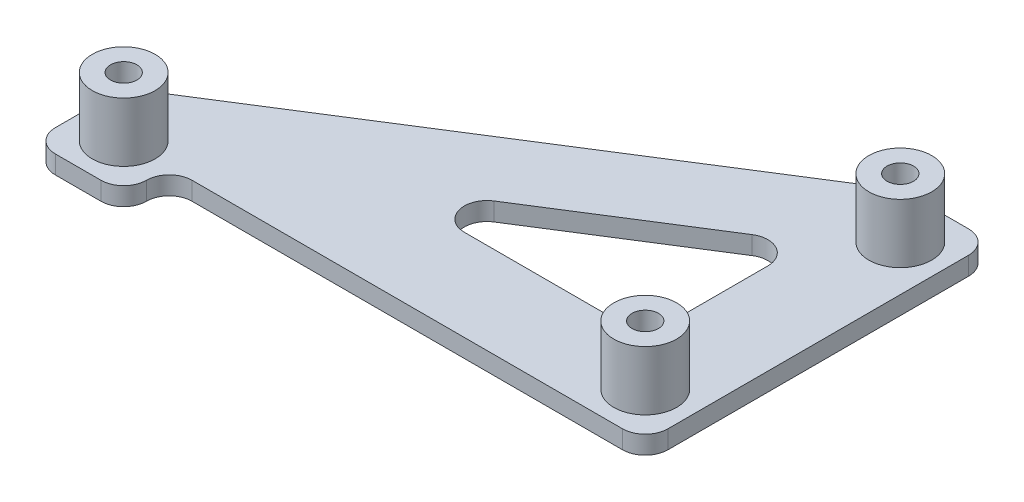
from build123d import *

# Parameters (mm, degrees)
SKETCH1_R             = 3.45
SKETCH1_R_2           = 1.45
BOSS_EXTRUDE1_DEPTH   = 8.5
BOSS_EXTRUDE1_2_DEPTH = 8.5
BOSS_EXTRUDE1_3_DEPTH = 8.5
SKETCH2_R             = 1.45
BOSS_EXTRUDE2_DEPTH   = 2
FILLET2_R             = 2.5


with BuildPart() as part:
    # Sketch1 → Boss-Extrude1 (new body)
    with BuildSketch(Plane(origin=(0, 0, 0), x_dir=(1, 0, 0), z_dir=(0, 1, 0))):
        with Locations(Location((-52.25, 5, 0), (0, 0, 270))):
            Circle(SKETCH1_R)
        with Locations(Location((-52.25, 5, 0), (0, 0, 270))):
            Circle(SKETCH1_R_2, mode=Mode.SUBTRACT)
    extrude(amount=BOSS_EXTRUDE1_DEPTH)



with BuildPart() as body_2:
    # Sketch1 → Boss-Extrude1 2 (new body)
    with BuildSketch(Plane(origin=(0, 0, 0), x_dir=(1, 0, 0), z_dir=(0, 1, 0))):
        with Locations(Location((0, 0, 0), (0, 0, 270))):
            Circle(SKETCH1_R)
        with Locations(Location((0, 0, 0), (0, 0, 270))):
            Circle(SKETCH1_R_2, mode=Mode.SUBTRACT)
    extrude(amount=BOSS_EXTRUDE1_2_DEPTH)


with BuildPart() as body_3:
    # Sketch1 → Boss-Extrude1 3 (new body)
    with BuildSketch(Plane(origin=(0, 0, 0), x_dir=(1, 0, 0), z_dir=(0, 1, 0))):
        with Locations(Location((0, -28, 0), (0, 0, 270))):
            Circle(SKETCH1_R)
        with Locations(Location((0, -28, 0), (0, 0, 270))):
            Circle(SKETCH1_R_2, mode=Mode.SUBTRACT)
    extrude(amount=BOSS_EXTRUDE1_3_DEPTH)


with BuildPart() as part_1:
    add(part.part)

    add(body_2.part)  # Boss-Extrude2 merges body 2

    add(body_3.part)  # Boss-Extrude2 merges body 3
    # Sketch2 → Boss-Extrude2 (add)
    with BuildSketch(Plane(origin=(0, 0, 0), x_dir=(1, 0, 0), z_dir=(0, 1, 0))):
        Polygon((5, 5), (5, -33), (-5, -33), (-57.25, 0), (-57.25, 10), (-47.25, 10), (-47.25, 5), align=None)
        with Locations(Location((-52.25, 5, 0), (0, 0, 270))):
            Circle(SKETCH2_R, mode=Mode.SUBTRACT)
        with Locations(Location((0, -28, 0), (0, 0, 270))):
            Circle(SKETCH2_R, mode=Mode.SUBTRACT)
        with Locations(Location((0, 0, 0), (0, 0, 270))):
            Circle(SKETCH2_R, mode=Mode.SUBTRACT)
        Polygon((-33.5, -5), (-5, -23), (-5, -5), align=None, mode=Mode.SUBTRACT)
    extrude(amount=BOSS_EXTRUDE2_DEPTH)

    # Fillet2
    fillet2_edges = [part_1.edges().sort_by_distance(p)[0] for p in [
        (-5, 1, 33),
        (-57.25, 1, 0),
        (-57.25, 1, -10),
        (-47.25, 1, -5),
        (5, 1, -5),
        (5, 1, 33),
        (-47.25, 1, -10),
        (-33.5, 1, 5),
        (-5, 1, 5),
        (-5, 1, 23),
    ]]
    fillet(fillet2_edges, radius=FILLET2_R - 0.0001)  # a hair under: the kernel refuses the full size


with BuildPart() as body_2_2:
    # Mirror1: mirrored copy
    add(part_1.part.mirror(Plane.XY))


solid = body_2_2.part
